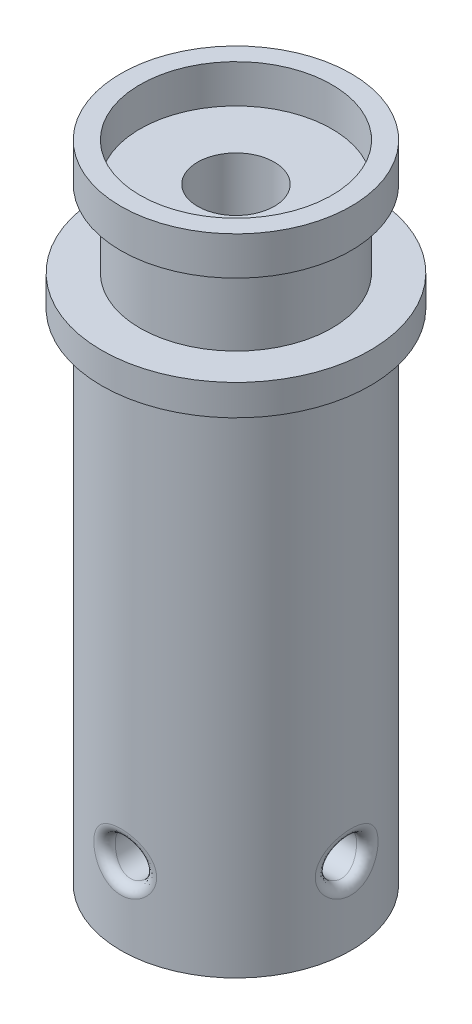
from build123d import *

# Parameters (mm, degrees)
SKETCH1_R           = 6
BOSS_EXTRUDE1_DEPTH = 12
SKETCH2_R           = 6
BOSS_EXTRUDE2_DEPTH = 14
SKETCH3_R           = 7
BOSS_EXTRUDE3_DEPTH = 1.6
SKETCH4_R           = 5
BOSS_EXTRUDE4_DEPTH = 4
SKETCH5_R           = 2
CUT_EXTRUDE1_DEPTH  = 34.114347344
SKETCH6_R           = 3
CUT_EXTRUDE2_DEPTH  = 20
CUT_EXTRUDE3_REACH  = 36.879
SKETCH8_R           = 1
CIRPATTERN1_COUNT   = 2
CIRPATTERN1_ANGLE   = 90
FILLET1_R           = 0.5
SKETCH9_R           = 6
SKETCH9_R_2         = 5
BOSS_EXTRUDE5_DEPTH = 2
BOSS_EXTRUDE6_START = -21.6
SKETCH9_2_R         = 6
SKETCH9_2_R_2       = 5
BOSS_EXTRUDE6_DEPTH = 2
BOSS_EXTRUDE7_START = -11.8
SKETCH9_3_R         = 6
SKETCH9_3_R_2       = 5
BOSS_EXTRUDE7_DEPTH = 1
BOSS_EXTRUDE8_START = -8.8
SKETCH9_4_R         = 6
SKETCH9_4_R_2       = 5
BOSS_EXTRUDE8_DEPTH = 1


with BuildPart() as part:
    # Sketch1 → Boss-Extrude1 (new body)
    with BuildSketch(Plane(origin=(0, 0, 0), x_dir=(1, 0, 0), z_dir=(0, 1, 0))):
        Circle(SKETCH1_R)
    extrude(amount=BOSS_EXTRUDE1_DEPTH)

    # Sketch2 → Boss-Extrude2 (add)
    with BuildSketch(Plane(origin=(0, 12, 0), x_dir=(1, 0, 0), z_dir=(0, 1, 0))):
        Circle(SKETCH2_R)
    extrude(amount=BOSS_EXTRUDE2_DEPTH)

    # Sketch3 → Boss-Extrude3 (add)
    with BuildSketch(Plane(origin=(0, 26, 0), x_dir=(1, 0, 0), z_dir=(0, 1, 0))):
        Circle(SKETCH3_R)
    extrude(amount=BOSS_EXTRUDE3_DEPTH)

    # Sketch4 → Boss-Extrude4 (add)
    with BuildSketch(Plane(origin=(0, 27.6, 0), x_dir=(1, 0, 0), z_dir=(0, 1, 0))):
        Circle(SKETCH4_R)
    extrude(amount=BOSS_EXTRUDE4_DEPTH)

    # Sketch5 → Cut-Extrude1 (cut, through all)
    with BuildSketch(Plane(origin=(0, 31.6, 0), x_dir=(1, 0, 0), z_dir=(0, 1, 0))):
        Circle(SKETCH5_R)
    extrude(amount=-CUT_EXTRUDE1_DEPTH, mode=Mode.SUBTRACT)

    # Sketch6 → Cut-Extrude2 (cut)
    with BuildSketch(Plane.XZ):
        Circle(SKETCH6_R)
    extrude(amount=-CUT_EXTRUDE2_DEPTH, mode=Mode.SUBTRACT)

    # Sketch8 → Cut-Extrude3 (cut, up to next)
    with BuildSketch(Plane.XY.offset(6), mode=Mode.PRIVATE) as cut_extrude3_sk1:
        with Locations((0, 4)):
            Circle(SKETCH8_R)
    cut_extrude3_tool1 = extrude(cut_extrude3_sk1.sketch, amount=-CUT_EXTRUDE3_REACH, mode=Mode.PRIVATE) & part.part
    cut_extrude3 = cut_extrude3_tool1.solids().sort_by_distance((0, 4, 6))[0]
    add(cut_extrude3, mode=Mode.SUBTRACT)

    # CirPattern1: Cut-Extrude3 ×2 about axis
    cirpattern1_axis = Axis((0, 0, 0), (0, 1, 0))
    for i in range(1, CIRPATTERN1_COUNT):
        add(cut_extrude3.rotate(cirpattern1_axis, i * CIRPATTERN1_ANGLE / (CIRPATTERN1_COUNT - 1)), mode=Mode.SUBTRACT)

    # Fillet1
    fillet1_edges = [part.edges().sort_by_distance(p)[0] for p in [
        (5.916079783, 4, 1.000000007),
        (-1.000000007, 4, 5.916079783),
    ]]
    fillet(fillet1_edges, radius=FILLET1_R)

    # Sketch9<2> → Boss-Extrude6 (add)
    with BuildSketch(Plane(origin=(0, 31.6, 0), x_dir=(1, 0, 0), z_dir=(0, 1, 0)).offset(BOSS_EXTRUDE6_START)):
        Circle(SKETCH9_2_R)
        Circle(SKETCH9_2_R_2, mode=Mode.SUBTRACT)
    extrude(amount=BOSS_EXTRUDE6_DEPTH)

    # Sketch9<3> → Boss-Extrude7 (add)
    with BuildSketch(Plane(origin=(0, 31.6, 0), x_dir=(1, 0, 0), z_dir=(0, 1, 0)).offset(BOSS_EXTRUDE7_START)):
        Circle(SKETCH9_3_R)
        Circle(SKETCH9_3_R_2, mode=Mode.SUBTRACT)
    extrude(amount=BOSS_EXTRUDE7_DEPTH)

    # Sketch9<4> → Boss-Extrude8 (add)
    with BuildSketch(Plane(origin=(0, 31.6, 0), x_dir=(1, 0, 0), z_dir=(0, 1, 0)).offset(BOSS_EXTRUDE8_START)):
        Circle(SKETCH9_4_R)
        Circle(SKETCH9_4_R_2, mode=Mode.SUBTRACT)
    extrude(amount=BOSS_EXTRUDE8_DEPTH)


with BuildPart() as body_2:
    # Sketch9 → Boss-Extrude5 (new body)
    with BuildSketch(Plane(origin=(0, 31.6, 0), x_dir=(1, 0, 0), z_dir=(0, 1, 0))):
        Circle(SKETCH9_R)
        Circle(SKETCH9_R_2, mode=Mode.SUBTRACT)
    extrude(amount=BOSS_EXTRUDE5_DEPTH)


solid = Compound([part.part, body_2.part])
